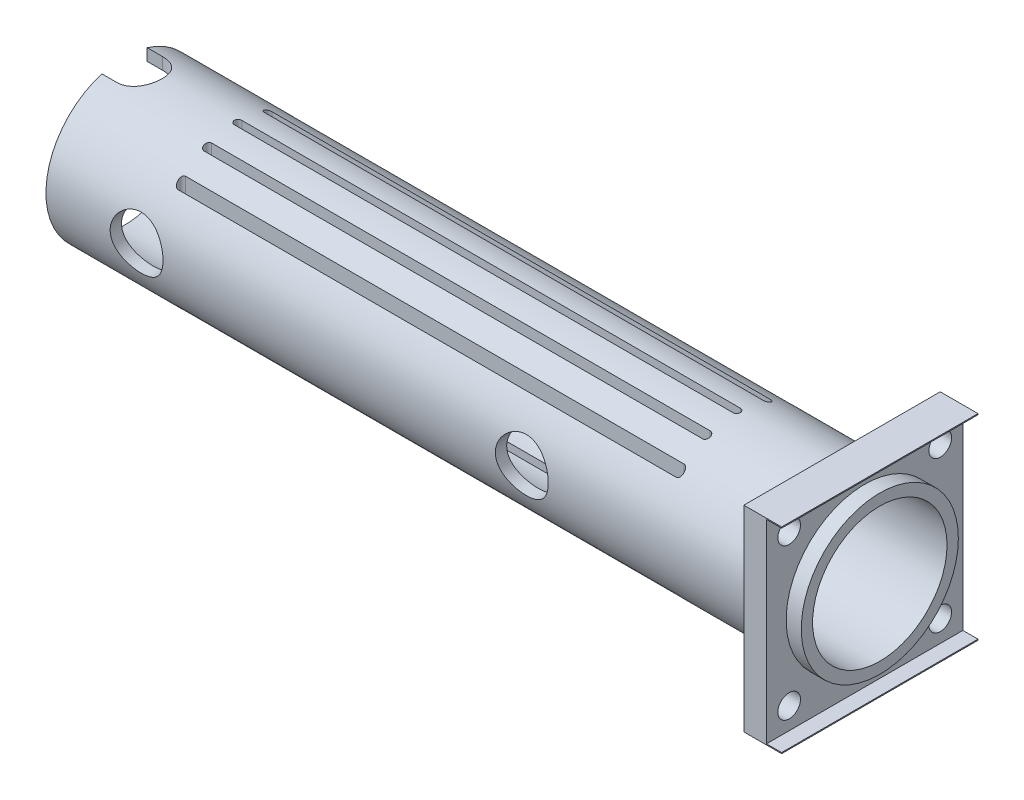
from build123d import *

# Parameters (mm, degrees)
SKETCH_2_W                  = 26
SKETCH_2_H                  = 26
SKETCH_2_R                  = 8.9
SKETCH_3_W                  = 33.415025294
SKETCH_3_H                  = 30.994995606
SKETCH_3_R                  = 10.4
CUT_EXTRUDE_2_DEPTH         = 95
CUT_EXTRUDE_START           = -2
SKETCH_4_W                  = 27.107370458
SKETCH_4_H                  = 25.72484519
SKETCH_4_R                  = 10.4
CUT_EXTRUDE_3_DEPTH         = 2
CUT_EXTRUDE_869_DEPTH       = 102.67595586
CUT_EXTRUDE_869_DEPTH_BACK  = 102.67595586
SKETCH_5_R                  = 3.5
CUT_EXTRUDE_U_DEPTH         = 102.675955958
CUT_EXTRUDE_1395_DEPTH      = 102.675955958
CUT_EXTRUDE_1395_DEPTH_BACK = 102.675955958
SKETCH_9_R                  = 1.5
CUT_EXTRUDE_1532_DEPTH      = 102.675955958


with BuildPart() as part:
    # 枪管1: sweep along a path in 草图1
    with BuildLine(Plane(origin=(0, 0, 0), x_dir=(1, 0, 0), z_dir=(0, 1, 0))) as sweep_1_path:
        Line((0, 0), (100, 0))
    # 草图2 → 枪管1 (sweep)
    with BuildSketch(Plane(origin=(0, 0, 0), x_dir=(0, 0, -1), z_dir=(1, 0, 0))):
        Rectangle(SKETCH_2_W, SKETCH_2_H)
        Circle(SKETCH_2_R, mode=Mode.SUBTRACT)
    sweep(path=sweep_1_path.line)

    # 草图3 → 枪管2 (cut)
    with BuildSketch(Plane(origin=(0, 0, 0), x_dir=(0, 0, -1), z_dir=(1, 0, 0))):
        Rectangle(SKETCH_3_W, SKETCH_3_H)
        Circle(SKETCH_3_R, mode=Mode.SUBTRACT)
    extrude(amount=CUT_EXTRUDE_2_DEPTH, mode=Mode.SUBTRACT)

    # 草图4 → 枪管3 (cut)
    with BuildSketch(Plane(origin=(100, 0, 0), x_dir=(0, 0, -1), z_dir=(1, 0, 0)).offset(CUT_EXTRUDE_START)):
        Rectangle(SKETCH_4_W, SKETCH_4_H)
        Circle(SKETCH_4_R, mode=Mode.SUBTRACT)
    extrude(amount=CUT_EXTRUDE_3_DEPTH, mode=Mode.SUBTRACT)

    # 草图5 → Cut-Extrude 869 (cut, two sides: drawn at the far end of the back side and taken through both)
    with BuildSketch(Plane.XY.offset(-CUT_EXTRUDE_869_DEPTH_BACK)):
        with Locations((12, 0)):
            Circle(SKETCH_5_R)
        with Locations((63, 0)):
            Circle(SKETCH_5_R)
    extrude(amount=CUT_EXTRUDE_869_DEPTH + CUT_EXTRUDE_869_DEPTH_BACK, mode=Mode.SUBTRACT)

    # 草图6 → 枪口U型口 (cut, through all)
    with BuildSketch(Plane(origin=(0, 0, 0), x_dir=(1, 0, 0), z_dir=(0, 1, 0))):
        with BuildLine():
            Line((-2, 3), (2, 3))
            ThreePointArc((2, 3), (5, 0), (2, -3))
            Line((2, -3), (-2, -3))
            ThreePointArc((-2, -3), (-5, 0), (-2, 3))
        make_face()
    extrude(amount=CUT_EXTRUDE_U_DEPTH, mode=Mode.SUBTRACT)

    # 草图7 → Cut-Extrude 1395 (cut, two sides: drawn at the far end of the back side and taken through both)
    with BuildSketch(Plane(origin=(0, 0, 0), x_dir=(1, 0, 0), z_dir=(0, 1, 0)).offset(-CUT_EXTRUDE_1395_DEPTH_BACK)):
        with BuildLine():
            Line((15.046963717, 0.5), (81.046963717, 0.5))
            ThreePointArc((81.046963717, 0.5), (81.546963717, 0), (81.046963717, -0.5))
            Line((81.046963717, -0.5), (15.046963717, -0.5))
            ThreePointArc((15.046963717, -0.5), (14.546963717, 0), (15.046963717, 0.5))
        make_face()
        with BuildLine():
            Line((15.046963717, -3.5), (81.046963717, -3.5))
            ThreePointArc((81.046963717, -3.5), (81.546963717, -4), (81.046963717, -4.5))
            Line((81.046963717, -4.5), (15.046963717, -4.5))
            ThreePointArc((15.046963717, -4.5), (14.546963717, -4), (15.046963717, -3.5))
        make_face()
        with BuildLine():
            Line((15.046963717, -6.966284037), (81.046963717, -6.966284037))
            ThreePointArc((81.046963717, -6.966284037), (81.546963717, -7.466284037), (81.046963717, -7.966284037))
            Line((81.046963717, -7.966284037), (15.046963717, -7.966284037))
            ThreePointArc((15.046963717, -7.966284037), (14.546963717, -7.466284037), (15.046963717, -6.966284037))
        make_face()
        with BuildLine():
            Line((15.046963717, 3.5), (81.046963717, 3.5))
            ThreePointArc((81.046963717, 3.5), (81.546963717, 4), (81.046963717, 4.5))
            Line((81.046963717, 4.5), (15.046963717, 4.5))
            ThreePointArc((15.046963717, 4.5), (14.546963717, 4), (15.046963717, 3.5))
        make_face()
        with BuildLine():
            Line((15.046963717, 6.966284037), (81.046963717, 6.966284037))
            ThreePointArc((81.046963717, 6.966284037), (81.546963717, 7.466284037), (81.046963717, 7.966284037))
            Line((81.046963717, 7.966284037), (15.046963717, 7.966284037))
            ThreePointArc((15.046963717, 7.966284037), (14.546963717, 7.466284037), (15.046963717, 6.966284037))
        make_face()
    extrude(amount=CUT_EXTRUDE_1395_DEPTH + CUT_EXTRUDE_1395_DEPTH_BACK, mode=Mode.SUBTRACT)

    # 草图9 → Cut-Extrude 1532 (cut, through all)
    with BuildSketch(Plane(origin=(100, 0, 0), x_dir=(0, 0, -1), z_dir=(1, 0, 0))):
        with Locations((-10, 10)):
            Circle(SKETCH_9_R)
        with Locations((10, 10)):
            Circle(SKETCH_9_R)
        with Locations((10, -10)):
            Circle(SKETCH_9_R)
        with Locations((-10, -10)):
            Circle(SKETCH_9_R)
    extrude(amount=-CUT_EXTRUDE_1532_DEPTH, mode=Mode.SUBTRACT)


solid = part.part
